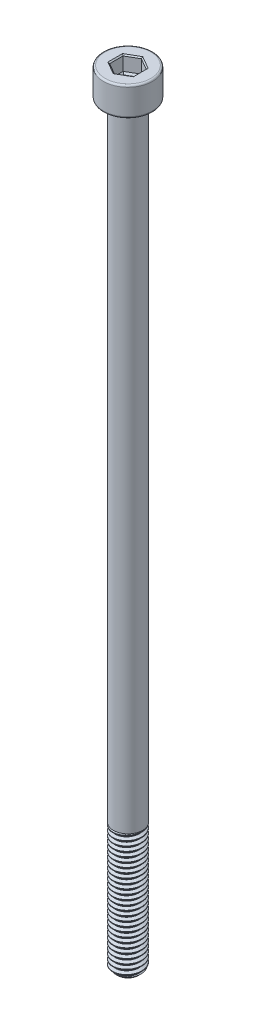
from build123d import *

# Parameters (mm, degrees)
SKETCH1_R           = 2.5
BOSS_EXTRUDE1_DEPTH = 22
THREAD1_PITCH       = 0.8
SKETCH2_R           = 2.5
BOSS_EXTRUDE2_DEPTH = 108
SKETCH3_R           = 4.25
BOSS_EXTRUDE3_DEPTH = 5
FILLET1_R           = 0.3
CUT_EXTRUDE1_DEPTH  = 2.5
CHAMFER1_SIZE       = 0.2
CUT_EXTRUDE2_DEPTH  = 0.3
CUT_EXTRUDE2_DRAFT  = -45


with BuildPart() as part:
    # Sketch1 → Boss-Extrude1 (new body)
    with BuildSketch(Plane(origin=(0, 0, 0), x_dir=(1, 0, 0), z_dir=(0, 1, 0))):
        with Locations(Location((0, 0, 0), (0, 0, 270))):
            Circle(SKETCH1_R)
    extrude(amount=BOSS_EXTRUDE1_DEPTH)

    # Thread1: the profile of Thread Profile1 profile screwed along a right-hand helix of 28.75 turns, 8 arcs to a turn; built about Z, then put on its axis
    thread1_z = Axis((0, 0, 0), (0, 0, 1))
    thread1_corners = [(2.5003, 0, -0.000173205), (2.5003, 0, 0.700173203), (2.0669873, 0, 0.449999999), (2.0669873, 0, 0.249999999)]
    with BuildLine(mode=Mode.PRIVATE) as thread1_profile:
        Line(thread1_corners[0], thread1_corners[1])
        Line(thread1_corners[1], thread1_corners[2])
        Line(thread1_corners[2], thread1_corners[3])
        Line(thread1_corners[3], thread1_corners[0])
    thread1_cap = Face(thread1_profile.wire())
    thread1_turn_angles = [0, 22.5, 45, 67.5, 90, 112.5, 135, 157.5, 180, 202.5, 225, 247.5, 270, 292.5, 315, 337.5, 360]
    thread1_turn_weights = [1, 0.9238795325112867, 1, 0.9238795325112867, 1, 0.9238795325112867, 1, 0.9238795325112867, 1, 0.9238795325112867, 1, 0.9238795325112867, 1, 0.9238795325112867, 1, 0.9238795325112867, 1]
    thread1_turn_rails = [Edge.make_bspline([Vector(p[0], p[1], 0).rotate(thread1_z, thread1_turn_angles[k]) / thread1_turn_weights[k] + Vector(0, 0, p[2] + THREAD1_PITCH * thread1_turn_angles[k] / 360) for k in range(17)], [0, 0, 0, 1, 1, 2, 2, 3, 3, 4, 4, 5, 5, 6, 6, 7, 7, 8, 8, 8], 2, thread1_turn_weights) for p in thread1_corners]
    thread1_turn_sides = [Face.make_surface_from_curves(thread1_turn_rails[p[0]], thread1_turn_rails[p[1]]) for p in [(0, 1), (1, 2), (2, 3), (3, 0)]]
    thread1_last_angles = [10080, 10102.5, 10125, 10147.5, 10170, 10192.5, 10215, 10237.5, 10260, 10282.5, 10305, 10327.5, 10350]
    thread1_last_weights = [1, 0.9238795325112867, 1, 0.9238795325112867, 1, 0.9238795325112867, 1, 0.9238795325112867, 1, 0.9238795325112867, 1, 0.9238795325112867, 1]
    thread1_last_rails = [Edge.make_bspline([Vector(p[0], p[1], 0).rotate(thread1_z, thread1_last_angles[k]) / thread1_last_weights[k] + Vector(0, 0, p[2] + THREAD1_PITCH * thread1_last_angles[k] / 360) for k in range(13)], [0, 0, 0, 1, 1, 2, 2, 3, 3, 4, 4, 5, 5, 6, 6, 6], 2, thread1_last_weights) for p in thread1_corners]
    thread1_last_sides = [Face.make_surface_from_curves(thread1_last_rails[p[0]], thread1_last_rails[p[1]]) for p in [(0, 1), (1, 2), (2, 3), (3, 0)]]
    thread1 = Plane(origin=(0, 23, 0), x_dir=(-1, 0, 0), z_dir=(0, -1, 0)) * Solid(Shell([*[p.moved(Location((0, 0, THREAD1_PITCH * i))) for i in range(28) for p in thread1_turn_sides], *thread1_last_sides, thread1_cap, thread1_cap.rotate(thread1_z, 10350).moved(Location((0, 0, THREAD1_PITCH * 10350 / 360)))]))
    add(thread1, mode=Mode.SUBTRACT)

    # Sketch2 → Boss-Extrude2 (add)
    with BuildSketch(Plane(origin=(0, 22, 0), x_dir=(1, 0, 0), z_dir=(0, 1, 0))):
        with Locations(Location((0, 0, 0), (0, 0, 90))):
            Circle(SKETCH2_R)
    extrude(amount=BOSS_EXTRUDE2_DEPTH)

    # Sketch3 → Boss-Extrude3 (add)
    with BuildSketch(Plane(origin=(0, 130, 0), x_dir=(1, 0, 0), z_dir=(0, 1, 0))):
        with Locations(Location((0, 0, 0), (0, 0, 270))):
            Circle(SKETCH3_R)
    extrude(amount=BOSS_EXTRUDE3_DEPTH)

    # Fillet1
    fillet1_edges = [part.edges().sort_by_distance(p)[0] for p in [
        (0, 130, -4.25),
        (0, 135, -4.25),
    ]]
    fillet(fillet1_edges, radius=FILLET1_R)

    # Sketch4 → Cut-Revolve1 (revolve, cut)
    with BuildSketch(Plane.XY, mode=Mode.PRIVATE) as cut_revolve1_sk:
        Polygon((2.51, 0), (2.51, 0.7), (1.81, 0), align=None)
    revolve(cut_revolve1_sk.sketch.rotate(Axis((0, 0, 0), (0, 1, 0)), 90), axis=Axis((0, 0, 0), (0, 1, 0)), mode=Mode.SUBTRACT)

    # Sketch5 → Cut-Extrude1 (cut)
    with BuildSketch(Plane(origin=(0, 135, 0), x_dir=(1, 0, 0), z_dir=(0, 1, 0))):
        Polygon((0, 2.309401077), (-2, 1.154700538), (-2, -1.154700538), (0, -2.309401077), (2, -1.154700538), (2, 1.154700538), align=None)
    extrude(amount=-CUT_EXTRUDE1_DEPTH, mode=Mode.SUBTRACT)

    # Chamfer1
    chamfer1_edges = [part.edges().sort_by_distance(p)[0] for p in [
        (1, 135, -1.732050808),
        (-1, 135, -1.732050808),
        (-2, 135, 0),
        (-1, 135, 1.732050808),
        (1, 135, 1.732050808),
        (2, 135, 0),
    ]]
    chamfer(chamfer1_edges, length=CHAMFER1_SIZE)


with BuildPart() as cut_extrude2_tool:
    # Sketch6 → Cut-Extrude2 (with draft: the straight prism first)
    with BuildSketch(Plane(origin=(0, 132.5, 0), x_dir=(1, 0, 0), z_dir=(0, 1, 0))):
        Polygon((0, 2.309401077), (-2, 1.154700538), (-2, -1.154700538), (0, -2.309401077), (2, -1.154700538), (2, 1.154700538), align=None)
    extrude(amount=-CUT_EXTRUDE2_DEPTH)
    # Cut-Extrude2: the draft: its side faces are tilted about the plane it starts from
    cut_extrude2_sides = [cut_extrude2_tool.faces().sort_by_distance(p)[0] for p in [
        (-1, 132.35, -1.732050808),
        (-2, 132.35, 0),
        (-1, 132.35, 1.732050808),
        (1, 132.35, 1.732050808),
        (2, 132.35, 0),
        (1, 132.35, -1.732050808),
    ]]
    draft(cut_extrude2_sides, Plane(origin=(0, 132.5, 0), x_dir=(1, 0, 0), z_dir=(0, 1, 0)), CUT_EXTRUDE2_DRAFT)


with BuildPart() as part_1:
    add(part.part)

    # Cut-Extrude2: cut by cut_extrude2_tool
    add(cut_extrude2_tool.part, mode=Mode.SUBTRACT)


solid = part_1.part
